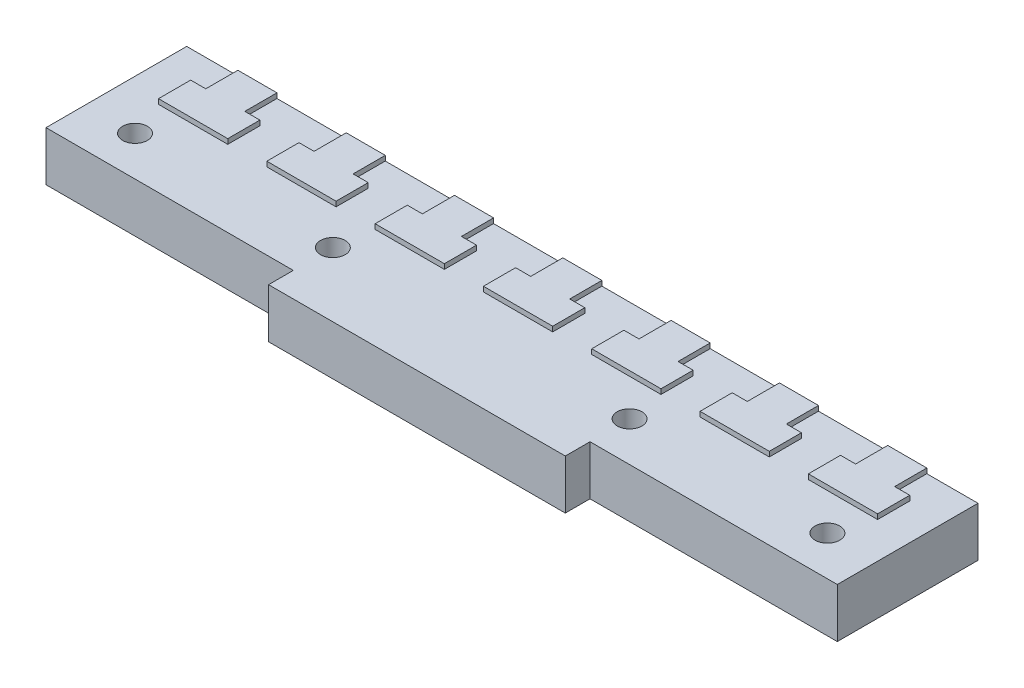
from build123d import *

# Parameters (mm, degrees)
SKETCH2_W           = 160
SKETCH2_H           = 28.45
BOSS_EXTRUDE1_DEPTH = 10
SKETCH4_W           = 60
SKETCH4_H           = 10
BOSS_EXTRUDE2_DEPTH = 5
SKETCH5_R           = 2.5
CUT_EXTRUDE1_DEPTH  = 83.883053907
BOSS_EXTRUDE3_DEPTH = 1


with BuildPart() as part:
    # Sketch2 → Boss-Extrude1 (new body)
    with BuildSketch(Plane(origin=(0, 0, 0), x_dir=(1, 0, 0), z_dir=(0, 1, 0))):
        Rectangle(SKETCH2_W, SKETCH2_H)
    extrude(amount=BOSS_EXTRUDE1_DEPTH)

    # Sketch4 → Boss-Extrude2 (add)
    with BuildSketch(Plane.XY.offset(14.225)):
        with Locations((0, 5)):
            Rectangle(SKETCH4_W, SKETCH4_H)
    extrude(amount=BOSS_EXTRUDE2_DEPTH)

    # Sketch5 → Cut-Extrude1 (cut, through all)
    with BuildSketch(Plane(origin=(0, 10, 0), x_dir=(1, 0, 0), z_dir=(0, 1, 0))):
        with Locations((70, -6.225)):
            Circle(SKETCH5_R)
        with Locations((30, -6.225)):
            Circle(SKETCH5_R)
        with Locations((-30, -6.225)):
            Circle(SKETCH5_R)
        with Locations((-70, -6.225)):
            Circle(SKETCH5_R)
    extrude(amount=-CUT_EXTRUDE1_DEPTH, mode=Mode.SUBTRACT)

    # Sketch6 → Boss-Extrude3 (add)
    with BuildSketch(Plane(origin=(0, 10, 0), x_dir=(1, 0, 0), z_dir=(0, 1, 0))):
        Polygon((3.95, 14.225), (3.95, 7.725), (7, 7.725), (7, 1.225), (0, 1.225), (-7, 1.225), (-7, 7.725), (-3.95, 7.725), (-3.95, 14.225), align=None)
        Polygon((-17.95, 14.225), (-25.85, 14.225), (-25.85, 7.725), (-28.9, 7.725), (-28.9, 1.225), (-21.9, 1.225), (-14.9, 1.225), (-14.9, 7.725), (-17.95, 7.725), align=None)
        Polygon((-39.85, 14.225), (-47.75, 14.225), (-47.75, 7.725), (-50.8, 7.725), (-50.8, 1.225), (-43.8, 1.225), (-36.8, 1.225), (-36.8, 7.725), (-39.85, 7.725), align=None)
        Polygon((-61.75, 14.225), (-69.65, 14.225), (-69.65, 7.725), (-72.7, 7.725), (-72.7, 1.225), (-65.7, 1.225), (-58.7, 1.225), (-58.7, 7.725), (-61.75, 7.725), align=None)
        Polygon((25.85, 14.225), (17.95, 14.225), (17.95, 7.725), (14.9, 7.725), (14.9, 1.225), (21.9, 1.225), (28.9, 1.225), (28.9, 7.725), (25.85, 7.725), align=None)
        Polygon((47.75, 14.225), (39.85, 14.225), (39.85, 7.725), (36.8, 7.725), (36.8, 1.225), (43.8, 1.225), (50.8, 1.225), (50.8, 7.725), (47.75, 7.725), align=None)
        Polygon((69.65, 14.225), (61.75, 14.225), (61.75, 7.725), (58.7, 7.725), (58.7, 1.225), (65.7, 1.225), (72.7, 1.225), (72.7, 7.725), (69.65, 7.725), align=None)
    extrude(amount=BOSS_EXTRUDE3_DEPTH)


solid = part.part
